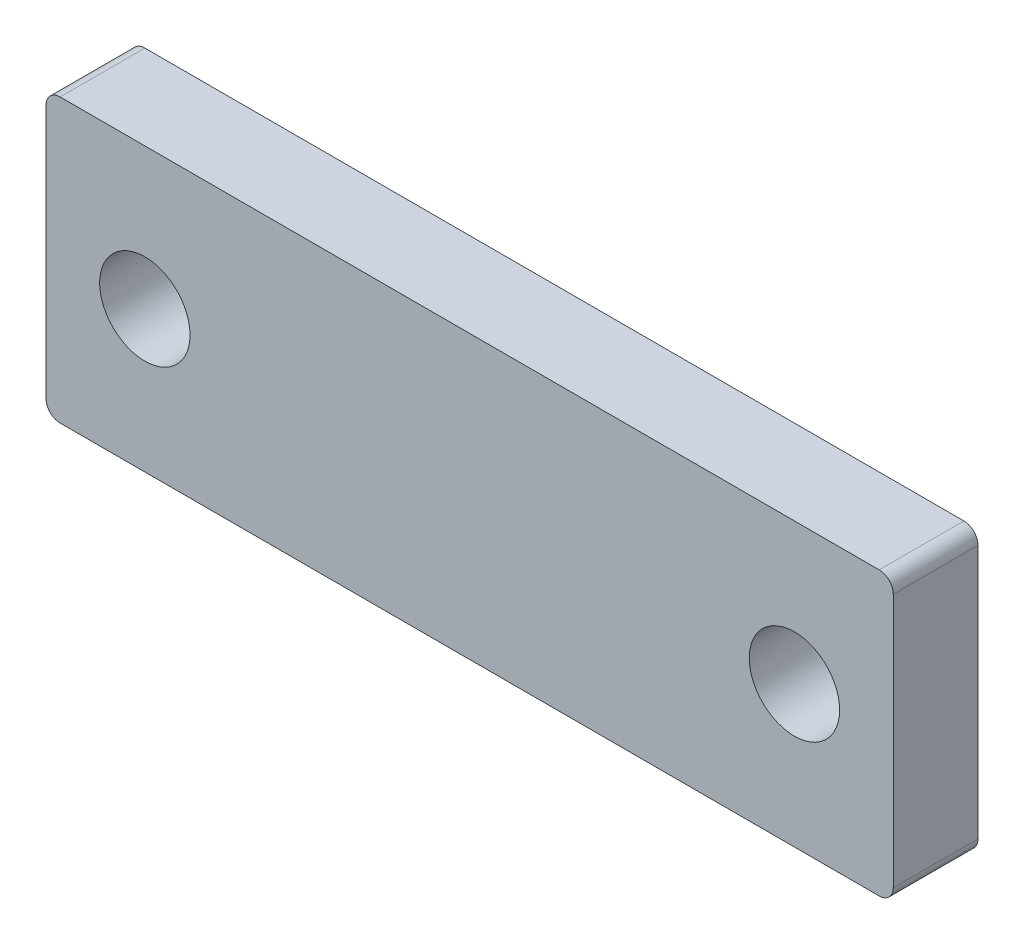
from build123d import *

# Parameters (mm, degrees)
SKETCH1_W            = 30
SKETCH1_H            = 10
BOSS_EXTRUDE1_DEPTH  = 3
M3_CLEARANCE_HOLE1_D = 3.2
FILLET1_R            = 0.5


with BuildPart() as part:
    # Sketch1 → Boss-Extrude1 (new body)
    with BuildSketch(Plane.XY):
        Rectangle(SKETCH1_W, SKETCH1_H)
    extrude(amount=BOSS_EXTRUDE1_DEPTH)

    # M3 Clearance Hole1 (through all)
    with Locations(Plane.XY.offset(3)):
        with Locations((-11.5, 0), (11.5, 0)):
            Hole(M3_CLEARANCE_HOLE1_D / 2)

    # Fillet1
    fillet1_edges = [part.edges().sort_by_distance(p)[0] for p in [
        (15, 5, 1.5),
        (15, -5, 1.5),
        (-15, -5, 1.5),
        (-15, 5, 1.5),
    ]]
    fillet(fillet1_edges, radius=FILLET1_R)


solid = part.part
